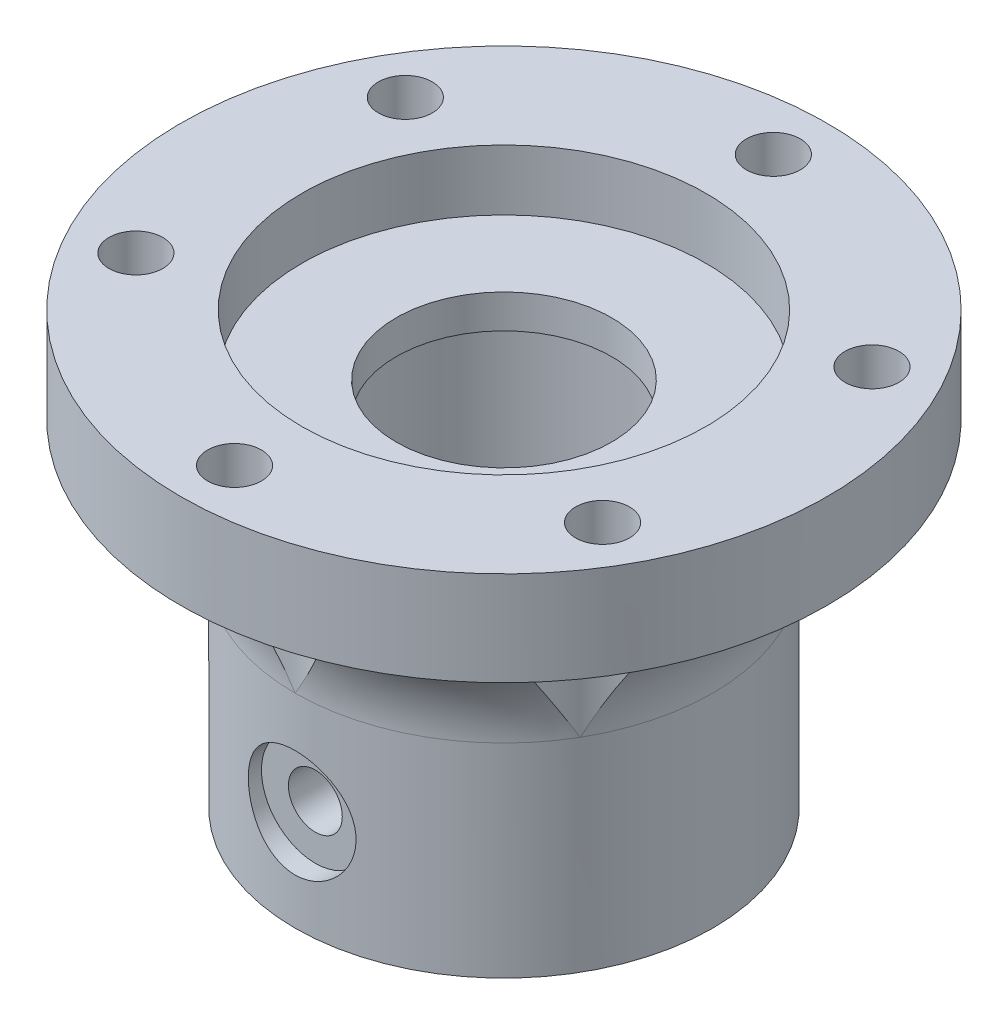
from build123d import *

# Parameters (mm, degrees)
SKETCH_1_R          = 15.5
SKETCH_1_R_2        = 10.5
EXTRUDE_1_DEPTH     = 25
SKETCH_3_R          = 24
EXTRUDE_2_DEPTH     = 7
FILLET_1_R          = 10
SKETCH_5_R          = 15
CUT_EXTRUDE_3_DEPTH = 4.5
SKETCH_6_R          = 8
CUT_EXTRUDE_4_DEPTH = 44.683520920365446
SKETCH_7_R          = 2.0000000000000018
SKETCH_7_R_2        = 2.0000000000000036
SKETCH_7_R_3        = 2.0000000000000004
SKETCH_7_R_4        = 2.0000000000000013
SKETCH_7_R_5        = 2.000000000000003
SKETCH_7_R_6        = 2
CUT_EXTRUDE_5_DEPTH = 47.64761515876246
CUT_EXTRUDE_START   = -7
SKETCH_8_R          = 4.500000000000001
SKETCH_8_R_2        = 4.500000000000002
SKETCH_8_R_3        = 4.5000000000000036
SKETCH_8_R_4        = 4.499999999999999
CUT_EXTRUDE_6_DEPTH = 10
SKETCH_9_R          = 2
CUT_EXTRUDE_7_DEPTH = 20
CUT_EXTRUDE_START_2 = -14
SKETCH_11_R         = 4
CUT_EXTRUDE_8_DEPTH = 40
CUT_EXTRUDE_START_3 = 54
SKETCH_12_R         = 4
CUT_EXTRUDE_9_DEPTH = 40


with BuildPart() as part:
    # Эскиз1 → Вытянуть1 (new body)
    with BuildSketch(Plane(origin=(0, 0, 0), x_dir=(1, 0, 0), z_dir=(0, 1, 0))):
        with Locations(Location((0, 0, 0), (0, 0, 270))):
            Circle(SKETCH_1_R)
        with Locations(Location((0, 0, 0), (0, 0, 270))):
            Circle(SKETCH_1_R_2, mode=Mode.SUBTRACT)
    extrude(amount=EXTRUDE_1_DEPTH)

    # Эскиз3 → Вытянуть2 (add)
    with BuildSketch(Plane(origin=(0, 25, 0), x_dir=(1, 0, 0), z_dir=(0, 1, 0))):
        with Locations(Location((0, 0, 0), (0, 0, 270))):
            Circle(SKETCH_3_R)
    extrude(amount=EXTRUDE_2_DEPTH)

    # Скругление1
    # the kernel refuses this fillet: 10 mm, written as the material it adds along each edge
    with BuildSketch(Plane(origin=(0, 25, 0), x_dir=(-1.8e-16, 0, 1), z_dir=(-1, 0, -1.8e-16))) as fillet_1_piece_1:
        with BuildLine():
            CenterArc((25.5, -9.886859966642819), FILLET_1_R, 98.62692655867845, 81.37307344132155)
            Line((15.5, -9.886859966642819), (15.3, -9.886859966642819))
            Line((15.3, -9.886859966642819), (15.3, 0))
            Line((15.3, 0), (15.5, 0.1999999999999993))
            ThreePointArc((15.5, 0.1999999999999993), (19.750000000000014, 0.1999999999999993), (23.970000000000034, 0.19773719933263223))
            Line((23.970000000000034, 0.19773719933263223), (24.000000000000032, -2.2027e-13))
        make_face()
    revolve(axis=Axis((0, 25, 0), (0, 1, 0)))

    # Эскиз5 → Вытянуть3 (cut)
    with BuildSketch(Plane(origin=(0, 32, 0), x_dir=(1, 0, 0), z_dir=(0, 1, 0))):
        with Locations(Location((0, 0, 0), (0, 0, 270))):
            Circle(SKETCH_5_R)
    extrude(amount=-CUT_EXTRUDE_3_DEPTH, mode=Mode.SUBTRACT)

    # Эскиз6 → Вытянуть4 (cut, through all)
    with BuildSketch(Plane(origin=(0, 27.5, 0), x_dir=(1, 0, 0), z_dir=(0, 1, 0))):
        with Locations(Location((0, 0, 0), (0, 0, 270))):
            Circle(SKETCH_6_R)
    extrude(amount=-CUT_EXTRUDE_4_DEPTH, mode=Mode.SUBTRACT)

    # Эскиз7 → Вытянуть5 (cut, through all)
    with BuildSketch(Plane(origin=(0, 32, 0), x_dir=(1, 0, 0), z_dir=(0, 1, 0))):
        with Locations(Location((0, -20, 0), (0, 0, 270))):
            Circle(SKETCH_7_R)
        with Locations(Location((-17.320508075688796, -9.999999999999961, 0), (0, 0, 270))):
            Circle(SKETCH_7_R_2)
        with Locations(Location((-17.320508075688732, 10.00000000000008, 0), (0, 0, 270))):
            Circle(SKETCH_7_R_3)
        with Locations(Location((1.3966e-13, 20, 0), (0, 0, 270))):
            Circle(SKETCH_7_R_4)
        with Locations(Location((17.32050807568886, 9.999999999999838, 0), (0, 0, 270))):
            Circle(SKETCH_7_R_5)
        with Locations(Location((17.320508075688657, -10.000000000000204, 0), (0, 0, 270))):
            Circle(SKETCH_7_R_6)
    extrude(amount=-CUT_EXTRUDE_5_DEPTH, mode=Mode.SUBTRACT)

    # Эскиз8 → Вытянуть6 (cut)
    with BuildSketch(Plane(origin=(0, 32, 0), x_dir=(1, 0, 0), z_dir=(0, 1, 0)).offset(CUT_EXTRUDE_START)):
        with Locations((0, -20)):
            Circle(SKETCH_8_R)
        with Locations((-17.320508075688796, -9.999999999999961)):
            Circle(SKETCH_8_R_2)
        with Locations((-17.320508075688732, 10.00000000000008)):
            Circle(SKETCH_8_R)
        with Locations((1.3966e-13, 20)):
            Circle(SKETCH_8_R)
        with Locations((17.32050807568886, 9.999999999999838)):
            Circle(SKETCH_8_R_3)
        with Locations((17.320508075688657, -10.000000000000204)):
            Circle(SKETCH_8_R_4)
    extrude(amount=-CUT_EXTRUDE_6_DEPTH, mode=Mode.SUBTRACT)

    # Эскиз9 → Вытянуть7 (cut, symmetric)
    with BuildSketch(Plane.XY):
        with Locations((0, 7.423633946327345)):
            Circle(SKETCH_9_R)
    extrude(amount=CUT_EXTRUDE_7_DEPTH, both=True, mode=Mode.SUBTRACT)

    # Эскиз11 → Вытянуть8 (cut)
    with BuildSketch(Plane.XY.offset(CUT_EXTRUDE_START_2)):
        with Locations((0, 7.423633946327345)):
            Circle(SKETCH_11_R)
    extrude(amount=-CUT_EXTRUDE_8_DEPTH, mode=Mode.SUBTRACT)

    # Эскиз12 → Вытянуть9 (cut)
    with BuildSketch(Plane.XY.offset(CUT_EXTRUDE_START_3)):
        with Locations((0, 7.423633946327345)):
            Circle(SKETCH_12_R)
    extrude(amount=-CUT_EXTRUDE_9_DEPTH, mode=Mode.SUBTRACT)


solid = part.part
